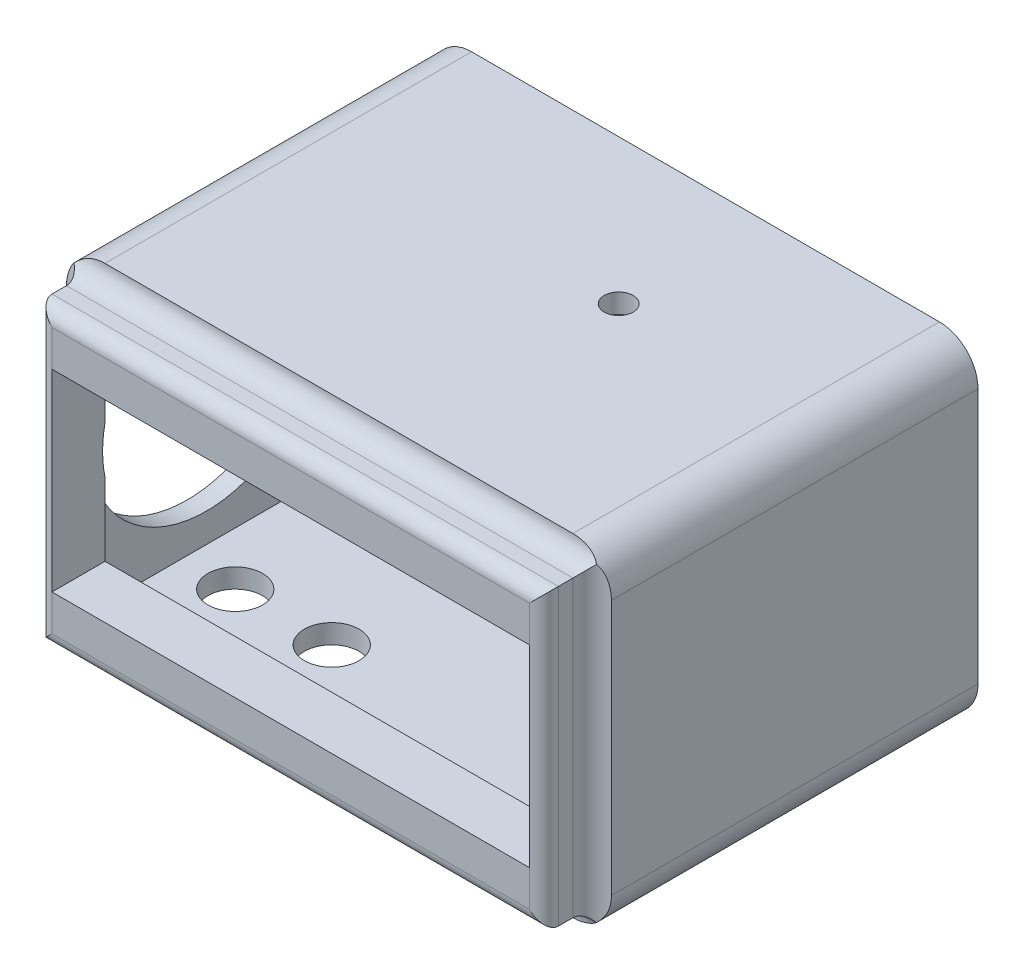
from build123d import *

# Parameters (mm, degrees)
IZIM1_W                     = 105
IZIM1_H                     = 61
IZIM1_W_2                   = 99
IZIM1_H_2                   = 40
Y_KSEKLIK_EKSTR_ZYON1_DEPTH = 11
IZIM2_W                     = 113
IZIM2_H                     = 69
IZIM2_W_2                   = 105
IZIM2_H_2                   = 61
Y_KSEKLIK_EKSTR_ZYON2_DEPTH = 70
IZIM3_W                     = 113
IZIM3_H                     = 69
IZIM3_W_2                   = 99
IZIM3_H_2                   = 40
Y_KSEKLIK_EKSTR_ZYON3_DEPTH = 1
IZIM4_R                     = 24.5
KES_EKSTR_ZYON1_DEPTH       = 7
IZIM5_R                     = 3
KES_EKSTR_ZYON2_DEPTH       = 7
IZIM6_R                     = 5.666240849
IZIM6_W                     = 11
IZIM6_H                     = 10
KES_EKSTR_ZYON3_DEPTH       = 7
RADYUS1_R                   = 4
RADYUS2_R                   = 3
RADYUS4_R                   = 8
IZIM14_W                    = 105
IZIM14_H                    = 61
Y_KSEKLIK_EKSTR_ZYON8_DEPTH = 5


# Some blends are built 0.0001 mm under size
with BuildPart() as part:
    # Çizim1 → Yükseklik-Ekstrüzyon1 (new body)
    with BuildSketch(Plane.XY):
        Rectangle(IZIM1_W, IZIM1_H)
        Rectangle(IZIM1_W_2, IZIM1_H_2, mode=Mode.SUBTRACT)
    extrude(amount=Y_KSEKLIK_EKSTR_ZYON1_DEPTH)



with BuildPart() as body_2:
    # Çizim2 → Yükseklik-Ekstrüzyon2 (new body)
    with BuildSketch(Plane(origin=(0, 0, 0), x_dir=(-1, 0, 0), z_dir=(0, 0, -1))):
        Rectangle(IZIM2_W, IZIM2_H)
        Rectangle(IZIM2_W_2, IZIM2_H_2, mode=Mode.SUBTRACT)
    extrude(amount=Y_KSEKLIK_EKSTR_ZYON2_DEPTH)


with BuildPart() as part_1:
    add(part.part)

    add(body_2.part)  # Yükseklik-Ekstrüzyon3 merges body 2
    # Çizim3 → Yükseklik-Ekstrüzyon3 (add)
    with BuildSketch(Plane.XY):
        Rectangle(IZIM3_W, IZIM3_H)
        Rectangle(IZIM3_W_2, IZIM3_H_2, mode=Mode.SUBTRACT)
    extrude(amount=Y_KSEKLIK_EKSTR_ZYON3_DEPTH)

    # Çizim4 → Kes-Ekstrüzyon1 (cut)
    with BuildSketch(Plane.ZY.offset(56.5)):
        with Locations((-24, 0)):
            Circle(IZIM4_R)
    extrude(amount=-KES_EKSTR_ZYON1_DEPTH, mode=Mode.SUBTRACT)

    # Çizim5 → Kes-Ekstrüzyon2 (cut)
    with BuildSketch(Plane(origin=(0, 34.5, 0), x_dir=(1, 0, 0), z_dir=(0, 1, 0))):
        with Locations(Location((12, 45, 0), (0, 0, 270))):
            Circle(IZIM5_R)
    extrude(amount=-KES_EKSTR_ZYON2_DEPTH, mode=Mode.SUBTRACT)

    # Çizim6 → Kes-Ekstrüzyon3 (cut)
    with BuildSketch(Plane(origin=(0, -34.5, 0), x_dir=(-1, 0, 0), z_dir=(0, -1, 0))):
        with Locations(Location((41.5, 19, 0), (0, 0, 90))):
            Circle(IZIM6_R)
        with Locations(Location((21.5, 19, 0), (0, 0, 90))):
            Circle(IZIM6_R)
        with Locations((-44, 20)):
            Rectangle(IZIM6_W, IZIM6_H)
    extrude(amount=-KES_EKSTR_ZYON3_DEPTH, mode=Mode.SUBTRACT)

    # Radyus1
    radyus1_edges = [part_1.edges().sort_by_distance(p)[0] for p in [
        (0, -30.5, 1),
        (52.5, 0, 1),
        (0, 30.5, 1),
        (-52.5, 0, 1),
    ]]
    fillet(radyus1_edges, radius=RADYUS1_R - 0.0001)  # a hair under: the kernel refuses the full size

    # Radyus2
    radyus2_edges = [part_1.edges().sort_by_distance(p)[0] for p in [
        (-52.5, 0, 11),
        (0, -30.5, 11),
        (52.5, 0, 11),
        (0, 30.5, 11),
    ]]
    fillet(radyus2_edges, radius=RADYUS2_R - 0.0001)  # a hair under: the kernel refuses the full size

    # Radyus4
    # the kernel refuses this fillet: 8 mm, written as the material it takes off along each edge
    with BuildSketch(Plane(origin=(56.5, -34.5, 21), x_dir=(0, 1, 0), z_dir=(0, 0, -1)), Plane(origin=(56.5, 34.5, 21), x_dir=(-1, 0, 0), z_dir=(0, 0, -1)), Plane(origin=(-56.5, 34.5, -90), x_dir=(1, 0, 0), z_dir=(0, 0, 1))) as radyus4_piece_1:
        with BuildLine():
            CenterArc((RADYUS4_R, -RADYUS4_R), RADYUS4_R, 90, 90)
            Line((0, -RADYUS4_R), (0, 0))
            Line((0, 0), (RADYUS4_R, 0))
        make_face()
    extrude(amount=111, mode=Mode.SUBTRACT)
    with BuildSketch(Plane(origin=(-56.5, -34.5, 21), x_dir=(0, 1, 0), z_dir=(0, 0, -1))) as radyus4_piece_2:
        with BuildLine():
            CenterArc((RADYUS4_R, RADYUS4_R), RADYUS4_R, 180, 90)
            Line((0, RADYUS4_R), (0, 0))
            Line((0, 0), (RADYUS4_R, 0))
        make_face()
    extrude(amount=111, mode=Mode.SUBTRACT)

    # Çizim14 → Yükseklik-Ekstrüzyon8 (add)
    with BuildSketch(Plane(origin=(0, 0, -70), x_dir=(-1, 0, 0), z_dir=(0, 0, -1))):
        with BuildLine():
            Line((-56.5, 26.5), (-56.5, -26.5))
            ThreePointArc((-56.5, -26.5), (-54.156854249, -32.156854249), (-48.5, -34.5))
            Line((-48.5, -34.5), (48.5, -34.5))
            ThreePointArc((48.5, -34.5), (54.156854249, -32.156854249), (56.5, -26.5))
            Line((56.5, -26.5), (56.5, 26.5))
            ThreePointArc((56.5, 26.5), (54.156854249, 32.156854249), (48.5, 34.5))
            Line((48.5, 34.5), (-48.5, 34.5))
            ThreePointArc((-48.5, 34.5), (-54.156854249, 32.156854249), (-56.5, 26.5))
        make_face()
        Rectangle(IZIM14_W, IZIM14_H, mode=Mode.SUBTRACT)
    extrude(amount=Y_KSEKLIK_EKSTR_ZYON8_DEPTH)


solid = part_1.part
